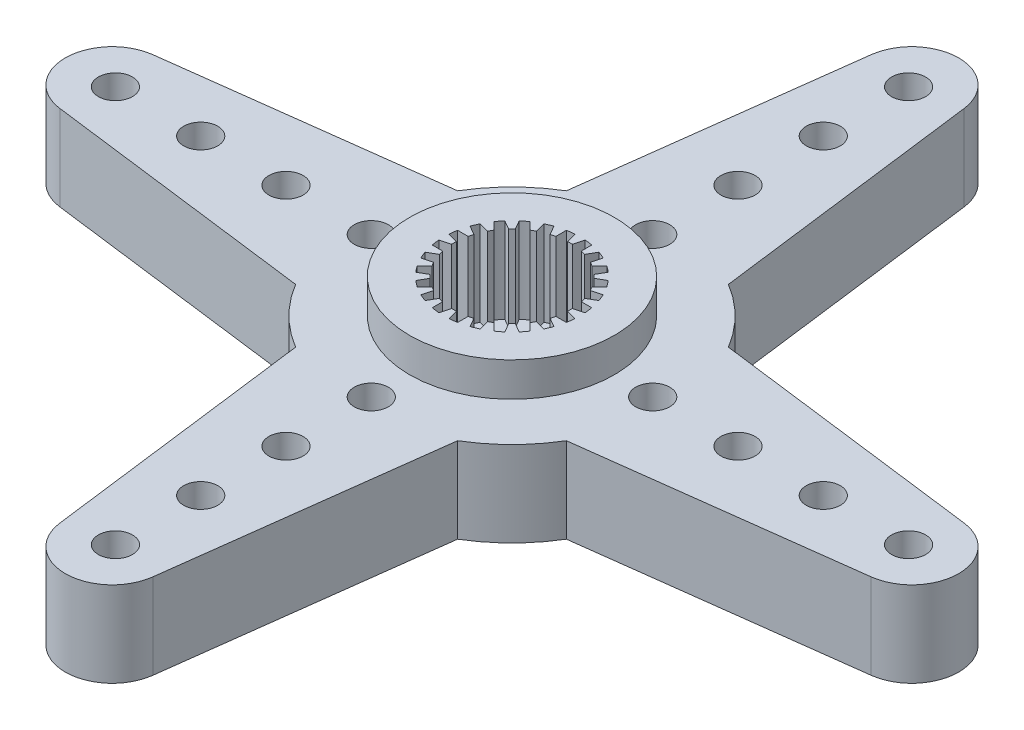
from build123d import *

# Parameters (mm, degrees)
ESQUISSE1_R                            = 9.25
ESQUISSE1_R_2                          = 1.65
BOSS_EXTRU_1_DEPTH                     = 8
BOSS_EXTRU_2_DEPTH                     = 8
R_P_TITION_CIRCULAIRE1_COUNT           = 4
ESQUISSE3_R                            = 1
ENL_V_MAT_EXTRU_1_DEPTH                = 8
R_P_TITION_LIN_AIRE1_COUNT             = 4
R_P_TITION_LIN_AIRE1_PITCH             = 5
R_P_TITION_CIRCULAIRE2_COUNT           = 4
R_P_TITION_CIRCULAIRE2_COPY_1_SKETCH_R = 1
R_P_TITION_CIRCULAIRE2_COPY_1_DEPTH    = 8
R_P_TITION_CIRCULAIRE2_COPY_2_SKETCH_R = 1
R_P_TITION_CIRCULAIRE2_COPY_2_DEPTH    = 8
R_P_TITION_CIRCULAIRE2_COPY_3_SKETCH_R = 1
R_P_TITION_CIRCULAIRE2_COPY_3_DEPTH    = 8
R_P_TITION_CIRCULAIRE2_COPY_4_SKETCH_R = 1
R_P_TITION_CIRCULAIRE2_COPY_4_DEPTH    = 8
R_P_TITION_CIRCULAIRE2_COPY_5_SKETCH_R = 1
R_P_TITION_CIRCULAIRE2_COPY_5_DEPTH    = 8
R_P_TITION_CIRCULAIRE2_COPY_6_SKETCH_R = 1
R_P_TITION_CIRCULAIRE2_COPY_6_DEPTH    = 8
R_P_TITION_CIRCULAIRE2_COPY_7_SKETCH_R = 1
R_P_TITION_CIRCULAIRE2_COPY_7_DEPTH    = 8
R_P_TITION_CIRCULAIRE2_COPY_8_SKETCH_R = 1
R_P_TITION_CIRCULAIRE2_COPY_8_DEPTH    = 8
R_P_TITION_CIRCULAIRE2_COPY_9_SKETCH_R = 1
R_P_TITION_CIRCULAIRE2_COPY_9_DEPTH    = 8
ESQUISSE4_W                            = 74.025208854
ESQUISSE4_H                            = 65.087506081
ESQUISSE4_R                            = 6
ENL_V_MAT_EXTRU_2_DEPTH                = 2
ESQUISSE5_R                            = 4
ENL_V_MAT_EXTRU_3_DEPTH                = 5
BOSS_EXTRU_3_DEPTH                     = 5
R_P_TITION_CIRCULAIRE3_COUNT           = 24
ESQUISSE7_R                            = 34.023023218
ESQUISSE7_R_2                          = 4.5
ENL_V_MAT_EXTRU_4_DEPTH                = 1
ESQUISSE8_R                            = 2.75
ENL_V_MAT_EXTRU_5_DEPTH                = 1
CHANFREIN1_SIZE                        = 1


with BuildPart() as part:
    # Esquisse1 → Boss.-Extru.1 (new body)
    with BuildSketch(Plane(origin=(0, 0, 0), x_dir=(1, 0, 0), z_dir=(0, 1, 0))):
        with Locations(Location((0, 0, 0), (0, 0, 270))):
            Circle(ESQUISSE1_R)
        with Locations(Location((0, 0, 0), (0, 0, 270))):
            Circle(ESQUISSE1_R_2, mode=Mode.SUBTRACT)
    extrude(amount=BOSS_EXTRU_1_DEPTH)

    # Esquisse2 → Boss.-Extru.2 (add)
    with BuildSketch(Plane(origin=(0, 8, 0), x_dir=(1, 0, 0), z_dir=(0, 1, 0))):
        with BuildLine():
            Line((-4.75, 7.937253933), (-2.7278844, 23.785315281))
            ThreePointArc((-2.7278844, 23.785315281), (0, 26.187253933), (2.7278844, 23.785315281))
            Line((2.7278844, 23.785315281), (4.75, 7.937253933))
            Line((4.75, 7.937253933), (-4.75, 7.937253933))
        make_face()
    boss_extru_2 = extrude(amount=-BOSS_EXTRU_2_DEPTH)

    # Répétition circulaire1: Boss.-Extru.2 ×4 about axis
    r_p_tition_circulaire1_axis = Axis((0, 0, 0), (0, 1, 0))
    for i in range(1, R_P_TITION_CIRCULAIRE1_COUNT):
        add(boss_extru_2.rotate(r_p_tition_circulaire1_axis, i * 360 / R_P_TITION_CIRCULAIRE1_COUNT))

    # Esquisse3 → Enlèv. mat.-Extru.1 (cut)
    with BuildSketch(Plane(origin=(0, 8, 0), x_dir=(1, 0, 0), z_dir=(0, 1, 0))):
        with Locations(Location((0, 8.25, 0), (0, 0, 270))):
            Circle(ESQUISSE3_R)
    enl_v_mat_extru_1 = extrude(amount=-ENL_V_MAT_EXTRU_1_DEPTH, mode=Mode.SUBTRACT)

    # Répétition linéaire1: Enlèv. mat.-Extru.1 ×4
    with Locations(*[(0, 0, -i * R_P_TITION_LIN_AIRE1_PITCH) for i in range(1, R_P_TITION_LIN_AIRE1_COUNT)]):
        add(enl_v_mat_extru_1, mode=Mode.SUBTRACT)

    # Répétition circulaire2: Enlèv. mat.-Extru.1 ×4 about axis
    r_p_tition_circulaire2_axis = Axis((0, 0, 0), (0, 1, 0))
    for i in range(1, R_P_TITION_CIRCULAIRE2_COUNT):
        add(enl_v_mat_extru_1.rotate(r_p_tition_circulaire2_axis, i * 360 / R_P_TITION_CIRCULAIRE2_COUNT), mode=Mode.SUBTRACT)

    # Répétition circulaire2 copy 1 sketch → Répétition circulaire2 copy 1 (cut)
    with BuildSketch(Plane(origin=(-5, 8, 0), x_dir=(0, 0, -1), z_dir=(0, 1, 0))):
        with Locations(Location((0, 8.25, 0), (0, 0, 270))):
            Circle(R_P_TITION_CIRCULAIRE2_COPY_1_SKETCH_R)
    extrude(amount=-R_P_TITION_CIRCULAIRE2_COPY_1_DEPTH, mode=Mode.SUBTRACT)

    # Répétition circulaire2 copy 2 sketch → Répétition circulaire2 copy 2 (cut)
    with BuildSketch(Plane(origin=(0, 8, 5), x_dir=(-1, 0, 0), z_dir=(0, 1, 0))):
        with Locations(Location((0, 8.25, 0), (0, 0, 270))):
            Circle(R_P_TITION_CIRCULAIRE2_COPY_2_SKETCH_R)
    extrude(amount=-R_P_TITION_CIRCULAIRE2_COPY_2_DEPTH, mode=Mode.SUBTRACT)

    # Répétition circulaire2 copy 3 sketch → Répétition circulaire2 copy 3 (cut)
    with BuildSketch(Plane(origin=(5, 8, 0), x_dir=(0, 0, 1), z_dir=(0, 1, 0))):
        with Locations(Location((0, 8.25, 0), (0, 0, 270))):
            Circle(R_P_TITION_CIRCULAIRE2_COPY_3_SKETCH_R)
    extrude(amount=-R_P_TITION_CIRCULAIRE2_COPY_3_DEPTH, mode=Mode.SUBTRACT)

    # Répétition circulaire2 copy 4 sketch → Répétition circulaire2 copy 4 (cut)
    with BuildSketch(Plane(origin=(-10, 8, 0), x_dir=(0, 0, -1), z_dir=(0, 1, 0))):
        with Locations(Location((0, 8.25, 0), (0, 0, 270))):
            Circle(R_P_TITION_CIRCULAIRE2_COPY_4_SKETCH_R)
    extrude(amount=-R_P_TITION_CIRCULAIRE2_COPY_4_DEPTH, mode=Mode.SUBTRACT)

    # Répétition circulaire2 copy 5 sketch → Répétition circulaire2 copy 5 (cut)
    with BuildSketch(Plane(origin=(0, 8, 10), x_dir=(-1, 0, 0), z_dir=(0, 1, 0))):
        with Locations(Location((0, 8.25, 0), (0, 0, 270))):
            Circle(R_P_TITION_CIRCULAIRE2_COPY_5_SKETCH_R)
    extrude(amount=-R_P_TITION_CIRCULAIRE2_COPY_5_DEPTH, mode=Mode.SUBTRACT)

    # Répétition circulaire2 copy 6 sketch → Répétition circulaire2 copy 6 (cut)
    with BuildSketch(Plane(origin=(10, 8, 0), x_dir=(0, 0, 1), z_dir=(0, 1, 0))):
        with Locations(Location((0, 8.25, 0), (0, 0, 270))):
            Circle(R_P_TITION_CIRCULAIRE2_COPY_6_SKETCH_R)
    extrude(amount=-R_P_TITION_CIRCULAIRE2_COPY_6_DEPTH, mode=Mode.SUBTRACT)

    # Répétition circulaire2 copy 7 sketch → Répétition circulaire2 copy 7 (cut)
    with BuildSketch(Plane(origin=(-15, 8, 0), x_dir=(0, 0, -1), z_dir=(0, 1, 0))):
        with Locations(Location((0, 8.25, 0), (0, 0, 270))):
            Circle(R_P_TITION_CIRCULAIRE2_COPY_7_SKETCH_R)
    extrude(amount=-R_P_TITION_CIRCULAIRE2_COPY_7_DEPTH, mode=Mode.SUBTRACT)

    # Répétition circulaire2 copy 8 sketch → Répétition circulaire2 copy 8 (cut)
    with BuildSketch(Plane(origin=(0, 8, 15), x_dir=(-1, 0, 0), z_dir=(0, 1, 0))):
        with Locations(Location((0, 8.25, 0), (0, 0, 270))):
            Circle(R_P_TITION_CIRCULAIRE2_COPY_8_SKETCH_R)
    extrude(amount=-R_P_TITION_CIRCULAIRE2_COPY_8_DEPTH, mode=Mode.SUBTRACT)

    # Répétition circulaire2 copy 9 sketch → Répétition circulaire2 copy 9 (cut)
    with BuildSketch(Plane(origin=(15, 8, 0), x_dir=(0, 0, 1), z_dir=(0, 1, 0))):
        with Locations(Location((0, 8.25, 0), (0, 0, 270))):
            Circle(R_P_TITION_CIRCULAIRE2_COPY_9_SKETCH_R)
    extrude(amount=-R_P_TITION_CIRCULAIRE2_COPY_9_DEPTH, mode=Mode.SUBTRACT)

    # Esquisse4 → Enlèv. mat.-Extru.2 (cut)
    with BuildSketch(Plane(origin=(0, 8, 0), x_dir=(1, 0, 0), z_dir=(0, 1, 0))):
        with Locations((-0.052574722, -0.420597777)):
            Rectangle(ESQUISSE4_W, ESQUISSE4_H)
        with Locations(Location((0, 0, 0), (0, 0, 270))):
            Circle(ESQUISSE4_R, mode=Mode.SUBTRACT)
    extrude(amount=-ENL_V_MAT_EXTRU_2_DEPTH, mode=Mode.SUBTRACT)

    # Esquisse5 → Enlèv. mat.-Extru.3 (cut)
    with BuildSketch(Plane(origin=(0, 8, 0), x_dir=(1, 0, 0), z_dir=(0, 1, 0))):
        with Locations(Location((0, 0, 0), (0, 0, 270))):
            Circle(ESQUISSE5_R)
    extrude(amount=-ENL_V_MAT_EXTRU_3_DEPTH, mode=Mode.SUBTRACT)

    # Esquisse6 → Boss.-Extru.3 (add)
    with BuildSketch(Plane(origin=(0, 8, 0), x_dir=(1, 0, 0), z_dir=(0, 1, 0))):
        Polygon((-0.3, 4), (-0.139230485, 3.4), (0.139230485, 3.4), (0.3, 4), align=None)
    boss_extru_3 = extrude(amount=-BOSS_EXTRU_3_DEPTH)

    # Répétition circulaire3: Boss.-Extru.3 ×24 about axis
    r_p_tition_circulaire3_axis = Axis((0, 0, 0), (0, 1, 0))
    for i in range(1, R_P_TITION_CIRCULAIRE3_COUNT):
        add(boss_extru_3.rotate(r_p_tition_circulaire3_axis, i * 360 / R_P_TITION_CIRCULAIRE3_COUNT))

    # Esquisse7 → Enlèv. mat.-Extru.4 (cut)
    with BuildSketch(Plane.XZ):
        Circle(ESQUISSE7_R)
        with Locations(Location((0, 0, 0), (0, 0, 270))):
            Circle(ESQUISSE7_R_2, mode=Mode.SUBTRACT)
    extrude(amount=-ENL_V_MAT_EXTRU_4_DEPTH, mode=Mode.SUBTRACT)

    # Esquisse8 → Enlèv. mat.-Extru.5 (cut)
    with BuildSketch(Plane.XZ):
        with Locations(Location((0, 0, 0), (0, 0, 270))):
            Circle(ESQUISSE8_R)
    extrude(amount=-ENL_V_MAT_EXTRU_5_DEPTH, mode=Mode.SUBTRACT)

    # Chanfrein1
    chanfrein1_edges = [part.edges().sort_by_distance(p)[0] for p in [
        (0, 1, 4.5),
    ]]
    chamfer(chanfrein1_edges, length=CHANFREIN1_SIZE - 0.0001)  # a hair under: the kernel refuses the full size


solid = part.part
